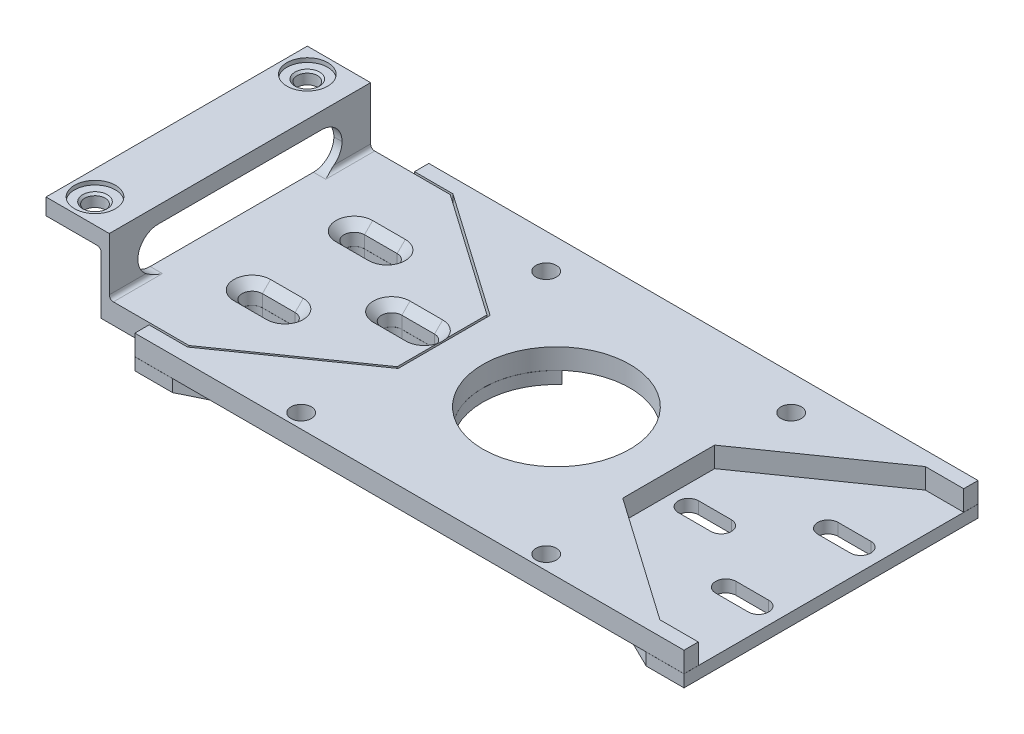
from build123d import *

# Parameters (mm, degrees)
SKETCH1_R                = 3.175
BOSS_EXTRUDE1_DEPTH      = 6.35
SKETCH10_W               = 19.685
SKETCH10_H               = 81.28
SKETCH10_R               = 3.175
BOSS_EXTRUDE4_DEPTH      = 17.78
SKETCH12_W               = 17.145
SKETCH12_H               = 81.28
CUT_EXTRUDE5_DEPTH       = 12.7
SKETCH14_R               = 6.35
CUT_EXTRUDE9_DEPTH       = 1.27
CHAMFER2_SIZE            = 0.635
SKETCH15_W               = 63.5
SKETCH15_H               = 12.7
CUT_EXTRUDE10_DEPTH      = 36.576
SKETCH16_W               = 17.145
SKETCH16_H               = 6.35
CUT_EXTRUDE11_DEPTH      = 84.836
FILLET1_R                = 1.27
FILLET2_START            = -31.75
FILLET2_DEPTH            = 6.3500001
FILLET2_START_2          = 25.3999999
FILLET2_2_DEPTH          = 6.3500001
FILLET2_START_3          = -30
FILLET2_3_DEPTH          = 6.505
SKETCH18_R               = 3.175
BOSS_EXTRUDE5_DEPTH      = 6.35
SKETCH19_R               = 22.86
CUT_EXTRUDE12_DEPTH      = 25.4
BOSS_EXTRUDE6_DEPTH      = 3.81
CUT_EXTRUDE13_DEPTH      = 78.74
CUT_EXTRUDE13_DEPTH_BACK = 56.896
SKETCH21_W               = 170.815
SKETCH21_H               = 0.0254
CUT_EXTRUDE15_DEPTH      = 56.896
SKETCH24_R               = 22.86
CUT_EXTRUDE16_DEPTH      = 56.896


with BuildPart() as part:
    # Sketch1 → Boss-Extrude1 (new body)
    with BuildSketch(Plane(origin=(0, 0, 0), x_dir=(1, 0, 0), z_dir=(0, 1, 0))):
        Polygon((0, 40.64), (38.1, 13.962092794), (38.1, -13.962092794), (0, -40.64), (-44.45, -40.64), (-44.45, 40.64), align=None)
        with Locations(Location((-36.83, 33.02, 0), (0, 0, 270))):
            Circle(SKETCH1_R, mode=Mode.SUBTRACT)
        with Locations(Location((-36.83, -33.02, 0), (0, 0, 270))):
            Circle(SKETCH1_R, mode=Mode.SUBTRACT)
        with BuildLine():
            Line((-5.08, 19.05), (5.08, 19.05))
            ThreePointArc((5.08, 19.05), (8.255, 15.875), (5.08, 12.7))
            Line((5.08, 12.7), (-5.08, 12.7))
            ThreePointArc((-5.08, 12.7), (-8.255, 15.875), (-5.08, 19.05))
        make_face(mode=Mode.SUBTRACT)
        with BuildLine():
            Line((-5.08, -12.7), (5.08, -12.7))
            ThreePointArc((5.08, -12.7), (8.255, -15.875), (5.08, -19.05))
            Line((5.08, -19.05), (-5.08, -19.05))
            ThreePointArc((-5.08, -19.05), (-8.255, -15.875), (-5.08, -12.7))
        make_face(mode=Mode.SUBTRACT)
        with BuildLine():
            Line((22.41630657, 3.175), (32.57630657, 3.175))
            ThreePointArc((32.57630657, 3.175), (35.75130657, 0), (32.57630657, -3.175))
            Line((32.57630657, -3.175), (22.41630657, -3.175))
            ThreePointArc((22.41630657, -3.175), (19.24130657, 0), (22.41630657, 3.175))
        make_face(mode=Mode.SUBTRACT)
    extrude(amount=BOSS_EXTRUDE1_DEPTH)

    # Sketch10 → Boss-Extrude4 (add)
    with BuildSketch(Plane(origin=(0, 6.35, 0), x_dir=(1, 0, 0), z_dir=(0, 1, 0))):
        with Locations((-34.6075, 0)):
            Rectangle(SKETCH10_W, SKETCH10_H)
        with Locations(Location((-36.83, -33.02, 0), (0, 0, 270))):
            Circle(SKETCH10_R, mode=Mode.SUBTRACT)
        with Locations(Location((-36.83, 33.02, 0), (0, 0, 270))):
            Circle(SKETCH10_R, mode=Mode.SUBTRACT)
    extrude(amount=BOSS_EXTRUDE4_DEPTH)

    # Sketch12 → Cut-Extrude5 (cut)
    with BuildSketch(Plane.XZ):
        with Locations((-35.8775, 0)):
            Rectangle(SKETCH12_W, SKETCH12_H)
    extrude(amount=-CUT_EXTRUDE5_DEPTH, mode=Mode.SUBTRACT)

    # Sketch14 → Cut-Extrude9 (cut)
    with BuildSketch(Plane(origin=(0, 24.13, 0), x_dir=(1, 0, 0), z_dir=(0, 1, 0))):
        with Locations(Location((-36.83, 33.02, 0), (0, 0, 270))):
            Circle(SKETCH14_R)
        with Locations(Location((-36.83, -33.02, 0), (0, 0, 270))):
            Circle(SKETCH14_R)
    extrude(amount=-CUT_EXTRUDE9_DEPTH, mode=Mode.SUBTRACT)

    # Chamfer2
    chamfer2_edges = [part.edges().sort_by_distance(p)[0] for p in [
        (-36.83, 22.86, -36.195),
        (-36.83, 22.86, 29.845),
    ]]
    chamfer(chamfer2_edges, length=CHAMFER2_SIZE)

    # Sketch15 → Cut-Extrude10 (cut)
    with BuildSketch(Plane(origin=(-24.765, 0, 0), x_dir=(0, 0, -1), z_dir=(1, 0, 0))):
        with Locations((0, 12.7)):
            Rectangle(SKETCH15_W, SKETCH15_H)
    extrude(amount=-CUT_EXTRUDE10_DEPTH, mode=Mode.SUBTRACT)

    # Sketch16 → Cut-Extrude11 (cut)
    with BuildSketch(Plane(origin=(0, 0, -40.64), x_dir=(-1, 0, 0), z_dir=(0, 0, -1))):
        with Locations((35.8775, 15.875)):
            Rectangle(SKETCH16_W, SKETCH16_H)
    extrude(amount=-CUT_EXTRUDE11_DEPTH, mode=Mode.SUBTRACT)

    # Fillet1
    fillet1_edges = [part.edges().sort_by_distance(p)[0] for p in [
        (-24.765, 6.35, -36.195),
        (-27.305, 19.05, 36.195),
        (-27.305, 19.05, -36.195),
        (-24.765, 6.35, 36.195),
    ]]
    fillet(fillet1_edges, radius=FILLET1_R)

    # Fillet2: read off the stored shape, not the designer's step
    # Fillet2 outline → Fillet2 (add)
    with BuildSketch(Plane.XY.offset(FILLET2_START)):
        with BuildLine():
            ThreePointArc((-23.495, 6.35), (-24.393025612, 6.721974388), (-24.765, 7.62))
            Line((-24.765, 7.62), (-24.765, 19.05))
            Line((-24.765, 19.05), (-28.575, 19.05))
            ThreePointArc((-28.575, 19.05), (-27.676974388, 18.678025612), (-27.305, 17.78))
            Line((-27.305, 17.78), (-27.305, 6.35))
            Line((-27.305, 6.35), (-23.495, 6.35))
        make_face()
    extrude(amount=FILLET2_DEPTH)

    # Fillet2 2 outline → Fillet2 2 (add)
    with BuildSketch(Plane.XY.offset(FILLET2_START_2)):
        with BuildLine():
            ThreePointArc((-23.495, 6.35), (-24.393025612, 6.721974388), (-24.765, 7.62))
            Line((-24.765, 7.62), (-24.765, 19.05))
            Line((-24.765, 19.05), (-28.575, 19.05))
            ThreePointArc((-28.575, 19.05), (-27.676974388, 18.678025612), (-27.305, 17.78))
            Line((-27.305, 17.78), (-27.305, 6.35))
            Line((-27.305, 6.35), (-23.495, 6.35))
        make_face()
    extrude(amount=FILLET2_2_DEPTH)

    # Fillet2 3 outline → Fillet2 3 (cut)
    with BuildSketch(Plane.YZ.offset(FILLET2_START_3)):
        with BuildLine():
            ThreePointArc((19.05, 25.4), (17.190128061, 29.890128061), (12.7, 31.75))
            ThreePointArc((12.7, 31.75), (8.209871939, 29.890128061), (6.35, 25.4))
            Line((6.35, 25.4), (19.05, 25.4))
        make_face()
        with BuildLine():
            ThreePointArc((12.7, -31.75), (17.190128061, -29.890128061), (19.05, -25.4))
            Line((19.05, -25.4), (6.35, -25.4))
            ThreePointArc((6.35, -25.4), (8.209871939, -29.890128061), (12.7, -31.75))
        make_face()
    extrude(amount=FILLET2_3_DEPTH, mode=Mode.SUBTRACT)

    # Chamfer3: read off the stored shape, not the designer's step
    # Chamfer3: loft between two sections, ruled curve by curve
    chamfer3_from = [
        Edge.make_three_point_arc((-5.08, 3.81, 12.7), (-7.32506403, 3.81, 13.62993597), (-8.255, 3.81, 15.875)),
        Edge.make_three_point_arc((-8.255, 3.81, 15.875), (-7.32506403, 3.81, 18.12006403), (-5.08, 3.81, 19.05)),
        Edge.make_three_point_arc((5.08, 3.81, 19.05), (7.32506403, 3.81, 18.12006403), (8.255, 3.81, 15.875)),
        Edge.make_three_point_arc((8.255, 3.81, 15.875), (7.32506403, 3.81, 13.62993597), (5.08, 3.81, 12.7)),
        Edge.make_line((5.08, 3.81, 12.7), (-5.08, 3.81, 12.7)),
        Edge.make_line((-5.08, 3.81, 19.05), (5.08, 3.81, 19.05)),
    ]
    chamfer3_to = [
        Edge.make_three_point_arc((-5.08, 6.35, 10.16), (-9.121115254, 6.35, 11.833884746), (-10.795, 6.35, 15.875)),
        Edge.make_three_point_arc((-10.795, 6.35, 15.875), (-9.121115254, 6.35, 19.916115254), (-5.08, 6.35, 21.59)),
        Edge.make_three_point_arc((5.08, 6.35, 21.59), (9.121115254, 6.35, 19.916115254), (10.795, 6.35, 15.875)),
        Edge.make_three_point_arc((10.795, 6.35, 15.875), (9.121115254, 6.35, 11.833884746), (5.08, 6.35, 10.16)),
        Edge.make_line((5.08, 6.35, 10.16), (-5.08, 6.35, 10.16)),
        Edge.make_line((-5.08, 6.35, 21.59), (5.08, 6.35, 21.59)),
    ]
    chamfer3 = Solid(Shell([*[Face.make_surface_from_curves(chamfer3_from[k], chamfer3_to[k]) for k in range(6)], Face(Wire(chamfer3_from)), Face(Wire(chamfer3_to))]))
    add(chamfer3, mode=Mode.SUBTRACT)

    # Chamfer3 2: loft between two sections, ruled curve by curve
    chamfer3_2_from = [
        Edge.make_three_point_arc((22.41630657, 3.81, -3.175), (20.17124254, 3.81, -2.24506403), (19.24130657, 3.81, 0)),
        Edge.make_three_point_arc((19.24130657, 3.81, 0), (20.17124254, 3.81, 2.24506403), (22.41630657, 3.81, 3.175)),
        Edge.make_three_point_arc((32.57630657, 3.81, 3.175), (34.8213706, 3.81, 2.24506403), (35.75130657, 3.81, 0)),
        Edge.make_three_point_arc((35.75130657, 3.81, 0), (34.8213706, 3.81, -2.24506403), (32.57630657, 3.81, -3.175)),
        Edge.make_line((32.57630657, 3.81, -3.175), (22.41630657, 3.81, -3.175)),
        Edge.make_line((22.41630657, 3.81, 3.175), (32.57630657, 3.81, 3.175)),
    ]
    chamfer3_2_to = [
        Edge.make_three_point_arc((22.41630657, 6.35, -5.715), (18.375191316, 6.35, -4.041115254), (16.70130657, 6.35, 0)),
        Edge.make_three_point_arc((16.70130657, 6.35, 0), (18.375191316, 6.35, 4.041115254), (22.41630657, 6.35, 5.715)),
        Edge.make_three_point_arc((32.57630657, 6.35, 5.715), (36.617421825, 6.35, 4.041115254), (38.29130657, 6.35, 0)),
        Edge.make_three_point_arc((38.29130657, 6.35, 0), (36.617421825, 6.35, -4.041115254), (32.57630657, 6.35, -5.715)),
        Edge.make_line((32.57630657, 6.35, -5.715), (22.41630657, 6.35, -5.715)),
        Edge.make_line((22.41630657, 6.35, 5.715), (32.57630657, 6.35, 5.715)),
    ]
    chamfer3_2 = Solid(Shell([*[Face.make_surface_from_curves(chamfer3_2_from[k], chamfer3_2_to[k]) for k in range(6)], Face(Wire(chamfer3_2_from)), Face(Wire(chamfer3_2_to))]))
    add(chamfer3_2, mode=Mode.SUBTRACT)

    # Chamfer3 3: loft between two sections, ruled curve by curve
    chamfer3_3_from = [
        Edge.make_three_point_arc((-5.08, 3.81, -19.05), (-7.32506403, 3.81, -18.12006403), (-8.255, 3.81, -15.875)),
        Edge.make_three_point_arc((-8.255, 3.81, -15.875), (-7.32506403, 3.81, -13.62993597), (-5.08, 3.81, -12.7)),
        Edge.make_three_point_arc((5.08, 3.81, -12.7), (7.32506403, 3.81, -13.62993597), (8.255, 3.81, -15.875)),
        Edge.make_three_point_arc((8.255, 3.81, -15.875), (7.32506403, 3.81, -18.12006403), (5.08, 3.81, -19.05)),
        Edge.make_line((5.08, 3.81, -19.05), (-5.08, 3.81, -19.05)),
        Edge.make_line((-5.08, 3.81, -12.7), (5.08, 3.81, -12.7)),
    ]
    chamfer3_3_to = [
        Edge.make_three_point_arc((-5.08, 6.35, -21.59), (-9.121115254, 6.35, -19.916115254), (-10.795, 6.35, -15.875)),
        Edge.make_three_point_arc((-10.795, 6.35, -15.875), (-9.121115254, 6.35, -11.833884746), (-5.08, 6.35, -10.16)),
        Edge.make_three_point_arc((5.08, 6.35, -10.16), (9.121115254, 6.35, -11.833884746), (10.795, 6.35, -15.875)),
        Edge.make_three_point_arc((10.795, 6.35, -15.875), (9.121115254, 6.35, -19.916115254), (5.08, 6.35, -21.59)),
        Edge.make_line((5.08, 6.35, -21.59), (-5.08, 6.35, -21.59)),
        Edge.make_line((-5.08, 6.35, -10.16), (5.08, 6.35, -10.16)),
    ]
    chamfer3_3 = Solid(Shell([*[Face.make_surface_from_curves(chamfer3_3_from[k], chamfer3_3_to[k]) for k in range(6)], Face(Wire(chamfer3_3_from)), Face(Wire(chamfer3_3_to))]))
    add(chamfer3_3, mode=Mode.SUBTRACT)



with BuildPart() as body_2:
    # Sketch18 → Boss-Extrude5 (new body)
    with BuildSketch(Plane(origin=(0, 6.35, 0), x_dir=(1, 0, 0), z_dir=(0, 1, 0))):
        Polygon((159.0675, -41.275), (159.0675, -45.72), (-11.7475, -45.72), (-11.7475, -41.275), (0.200214731, -41.275), (38.735, -14.292652871), (38.735, -1.466300069), (38.735, 1.466300069), (38.735, 14.292652871), (0.200214731, 41.275), (-11.7475, 41.275), (-11.7475, 45.72), (159.0675, 45.72), (159.0675, 41.275), (147.119785269, 41.275), (108.585, 14.292652871), (108.585, 1.466300069), (108.585, -1.466300069), (108.585, -14.292652871), (147.119785269, -41.275), align=None)
        with Locations(Location((111.76, -41.275, 0), (0, 0, 270))):
            Circle(SKETCH18_R, mode=Mode.SUBTRACT)
        with Locations(Location((35.56, -41.275, 0), (0, 0, 270))):
            Circle(SKETCH18_R, mode=Mode.SUBTRACT)
        with Locations(Location((111.76, 34.925, 0), (0, 0, 270))):
            Circle(SKETCH18_R, mode=Mode.SUBTRACT)
        with Locations(Location((35.56, 34.925, 0), (0, 0, 270))):
            Circle(SKETCH18_R, mode=Mode.SUBTRACT)
    extrude(amount=-BOSS_EXTRUDE5_DEPTH)

    # Sketch19 → Cut-Extrude12 (cut)
    with BuildSketch(Plane(origin=(0, 6.35, 0), x_dir=(1, 0, 0), z_dir=(0, 1, 0))):
        with Locations(Location((73.66, 0, 0), (0, 0, 270))):
            Circle(SKETCH19_R)
    extrude(amount=-CUT_EXTRUDE12_DEPTH, mode=Mode.SUBTRACT)


with BuildPart() as part_1:
    add(part.part)

    add(body_2.part)  # Boss-Extrude6 merges body 2
    # Sketch20 → Boss-Extrude6 (add)
    with BuildSketch(Plane.XZ):
        Polygon((-11.7475, 45.72), (-11.7475, -45.72), (0, -45.72), (73.66, -9.525), (147.32, -45.72), (159.0675, -45.72), (159.0675, 45.72), (147.32, 45.72), (73.66, 9.525), (0, 45.72), align=None)
    extrude(amount=BOSS_EXTRUDE6_DEPTH)

    # Sketch21 → Cut-Extrude13 (cut, two sides: drawn at the far end of the back side and taken through both)
    with BuildSketch(Plane.XY.offset(-CUT_EXTRUDE13_DEPTH_BACK)):
        with Locations((73.66, -0.0127)):
            Rectangle(SKETCH21_W, SKETCH21_H)
    extrude(amount=CUT_EXTRUDE13_DEPTH + CUT_EXTRUDE13_DEPTH_BACK, mode=Mode.SUBTRACT)


with BuildPart() as cut_extrude13_piece_1:
    # of the separate pieces the step leaves, piece 1, a body of its own (cut_extrude13_pieces)
    add(part_1.part.solids().sort_by_distance((-11.7475, 6.35, 41.275))[0])


with BuildPart() as cut_extrude13_piece_2:
    # of the separate pieces the step leaves, piece 2, a body of its own (cut_extrude13_pieces)
    add(part_1.part.solids().sort_by_distance((-11.7475, -3.81, 45.72))[0])

    # Sketch23 → Cut-Extrude15 (cut)
    with BuildSketch(Plane(origin=(0, 6.35, 0), x_dir=(1, 0, 0), z_dir=(0, 1, 0))):
        with BuildLine():
            Line((-5.08, -19.05), (5.08, -19.05))
            ThreePointArc((5.08, -19.05), (8.255, -15.875), (5.08, -12.7))
            Line((5.08, -12.7), (-5.08, -12.7))
            ThreePointArc((-5.08, -12.7), (-8.255, -15.875), (-5.08, -19.05))
        make_face()
        with BuildLine():
            Line((22.41630657, -3.175), (32.57630657, -3.175))
            ThreePointArc((32.57630657, -3.175), (35.75130657, 0), (32.57630657, 3.175))
            Line((32.57630657, 3.175), (22.41630657, 3.175))
            ThreePointArc((22.41630657, 3.175), (19.24130657, 0), (22.41630657, -3.175))
        make_face()
        with BuildLine():
            Line((-5.08, 12.7), (5.08, 12.7))
            ThreePointArc((5.08, 12.7), (8.255, 15.875), (5.08, 19.05))
            Line((5.08, 19.05), (-5.08, 19.05))
            ThreePointArc((-5.08, 19.05), (-8.255, 15.875), (-5.08, 12.7))
        make_face()
        with BuildLine():
            Line((142.24, -12.7), (152.4, -12.7))
            ThreePointArc((152.4, -12.7), (155.575, -15.875), (152.4, -19.05))
            Line((152.4, -19.05), (142.24, -19.05))
            ThreePointArc((142.24, -19.05), (139.065, -15.875), (142.24, -12.7))
        make_face()
        with BuildLine():
            Line((114.74369343, 3.175), (124.90369343, 3.175))
            ThreePointArc((124.90369343, 3.175), (128.07869343, 0), (124.90369343, -3.175))
            Line((124.90369343, -3.175), (114.74369343, -3.175))
            ThreePointArc((114.74369343, -3.175), (111.56869343, 0), (114.74369343, 3.175))
        make_face()
        with BuildLine():
            Line((142.24, 19.05), (152.4, 19.05))
            ThreePointArc((152.4, 19.05), (155.575, 15.875), (152.4, 12.7))
            Line((152.4, 12.7), (142.24, 12.7))
            ThreePointArc((142.24, 12.7), (139.065, 15.875), (142.24, 19.05))
        make_face()
    extrude(amount=-CUT_EXTRUDE15_DEPTH, mode=Mode.SUBTRACT)

    # Sketch24 → Cut-Extrude16 (cut)
    with BuildSketch(Plane(origin=(0, 6.35, 0), x_dir=(1, 0, 0), z_dir=(0, 1, 0))):
        with Locations(Location((73.66, 0, 0), (0, 0, 270))):
            Circle(SKETCH24_R)
    extrude(amount=-CUT_EXTRUDE16_DEPTH, mode=Mode.SUBTRACT)


with BuildPart() as cut_extrude13_piece_3:
    # of the separate pieces the step leaves, piece 3, a body of its own (cut_extrude13_pieces)
    add(part_1.part.solids().sort_by_distance((-23.495, 6.35, 40.64))[0])


with BuildPart() as cut_extrude16_piece_1:
    # of the separate pieces the step leaves, piece 1, a body of its own (cut_extrude16_pieces)
    add(cut_extrude13_piece_2.part.solids().sort_by_distance((-11.7475, -3.81, 45.72))[0])


with BuildPart() as cut_extrude16_piece_2:
    # of the separate pieces the step leaves, piece 2, a body of its own (cut_extrude16_pieces)
    add(cut_extrude13_piece_2.part.solids().sort_by_distance((147.32, -0.0254, -45.72))[0])


solid = Compound([cut_extrude13_piece_1.part, cut_extrude13_piece_3.part, cut_extrude16_piece_1.part, cut_extrude16_piece_2.part])
